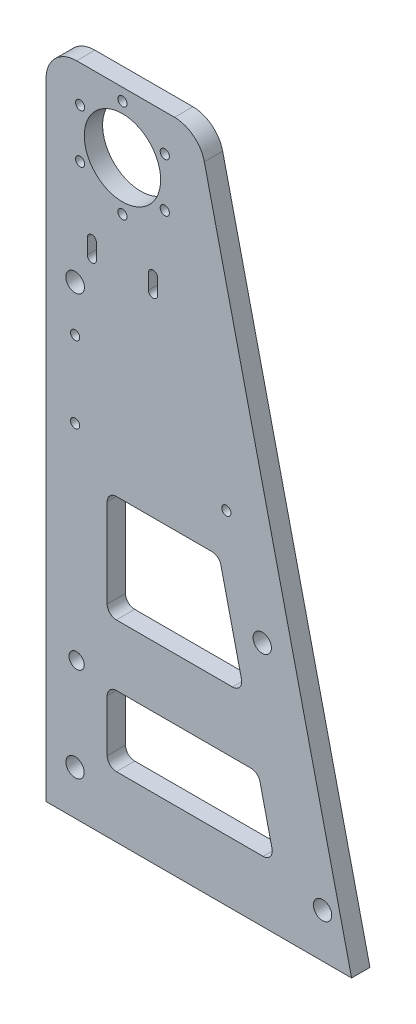
from build123d import *

# Parameters (mm, degrees)
ESBO_O1_R                = 12.5
ESBO_O1_R_2              = 1.5
ESBO_O1_R_3              = 2.5
RESSALTO_EXTRUS_O2_DEPTH = 6
FILETE1_R                = 10
ESBO_O2_R                = 1.5
ESBO_O2_R_2              = 3
ESBO_O2_R_3              = 3.05
CORTE_EXTRUS_O1_DEPTH    = 238.194013415
ESBO_O3_R                = 3
CORTE_EXTRUS_O2_DEPTH    = 238.194013415


with BuildPart() as part:
    # Esboço1 → Ressalto-extrusão2 (new body)
    with BuildSketch(Plane.XY):
        Polygon((0, 0), (0, 215), (50, 215), (100, 0), align=None)
        with Locations((25, 195)):
            Circle(ESBO_O1_R, mode=Mode.SUBTRACT)
        with Locations((25, 211)):
            Circle(ESBO_O1_R_2, mode=Mode.SUBTRACT)
        with Locations((38.856406461, 203)):
            Circle(ESBO_O1_R_2, mode=Mode.SUBTRACT)
        with Locations((38.856406461, 187)):
            Circle(ESBO_O1_R_2, mode=Mode.SUBTRACT)
        with Locations((25, 179)):
            Circle(ESBO_O1_R_2, mode=Mode.SUBTRACT)
        with Locations((11.143593539, 187)):
            Circle(ESBO_O1_R_2, mode=Mode.SUBTRACT)
        with Locations((11.143593539, 203)):
            Circle(ESBO_O1_R_2, mode=Mode.SUBTRACT)
        with Locations((10, 45)):
            Circle(ESBO_O1_R_3, mode=Mode.SUBTRACT)
        with BuildLine():
            Line((20, 95), (20, 66))
            ThreePointArc((20, 66), (20.878679656, 63.878679656), (23, 63))
            Line((23, 63), (61.03739436, 63))
            ThreePointArc((61.03739436, 63), (63.386715693, 64.134339454), (63.959418441, 66.679540484))
            Line((63.959418441, 66.679540484), (57.215232395, 95.679540484))
            ThreePointArc((57.215232395, 95.679540484), (56.15886886, 97.349321333), (54.293208314, 98))
            Line((54.293208314, 98), (23, 98))
            ThreePointArc((23, 98), (20.878679656, 97.121320344), (20, 95))
        make_face(mode=Mode.SUBTRACT)
        with BuildLine():
            Line((20, 40), (20, 23))
            ThreePointArc((20, 23), (20.878679656, 20.878679656), (23, 20))
            Line((23, 20), (71.03739436, 20))
            ThreePointArc((71.03739436, 20), (73.386715693, 21.134339454), (73.959418441, 23.679540484))
            Line((73.959418441, 23.679540484), (70.005930069, 40.679540484))
            ThreePointArc((70.005930069, 40.679540484), (68.949566534, 42.349321333), (67.083905988, 43))
            Line((67.083905988, 43), (23, 43))
            ThreePointArc((23, 43), (20.878679656, 42.121320344), (20, 40))
        make_face(mode=Mode.SUBTRACT)
    extrude(amount=RESSALTO_EXTRUS_O2_DEPTH)

    # Filete1
    filete1_edges = [part.edges().sort_by_distance(p)[0] for p in [
        (0, 215, 3),
        (50, 215, 3),
    ]]
    fillet(filete1_edges, radius=FILETE1_R)

    # Esboço2 → Corte-extrusão1 (cut, through all)
    with BuildSketch(Plane.XY.offset(6)):
        with Locations((9.5, 137)):
            Circle(ESBO_O2_R)
        with Locations((90.5, 14.5)):
            Circle(ESBO_O2_R_2)
        with Locations((9.5, 112)):
            Circle(ESBO_O2_R)
        with Locations((9.5, 152)):
            Circle(ESBO_O2_R_3)
        with Locations((59, 112)):
            Circle(ESBO_O2_R)
        with Locations((9.5, 14.5)):
            Circle(ESBO_O2_R_2)
        with BuildLine():
            Line((13.5, 161.71), (13.5, 166.71))
            ThreePointArc((13.5, 166.71), (15, 168.21), (16.5, 166.71))
            Line((16.5, 166.71), (16.5, 161.71))
            ThreePointArc((16.5, 161.71), (15, 160.21), (13.5, 161.71))
        make_face()
        with BuildLine():
            Line((33.5, 161.71), (33.5, 166.71))
            ThreePointArc((33.5, 166.71), (35, 168.21), (36.5, 166.71))
            Line((36.5, 166.71), (36.5, 161.71))
            ThreePointArc((36.5, 161.71), (35, 160.21), (33.5, 161.71))
        make_face()
    extrude(amount=-CORTE_EXTRUS_O1_DEPTH, mode=Mode.SUBTRACT)

    # Esboço3 → Corte-extrusão2 (cut, through all)
    with BuildSketch(Plane.XY.offset(6)):
        with Locations((70.759810426, 80.398555206)):
            Circle(ESBO_O3_R)
    extrude(amount=-CORTE_EXTRUS_O2_DEPTH, mode=Mode.SUBTRACT)


solid = part.part
